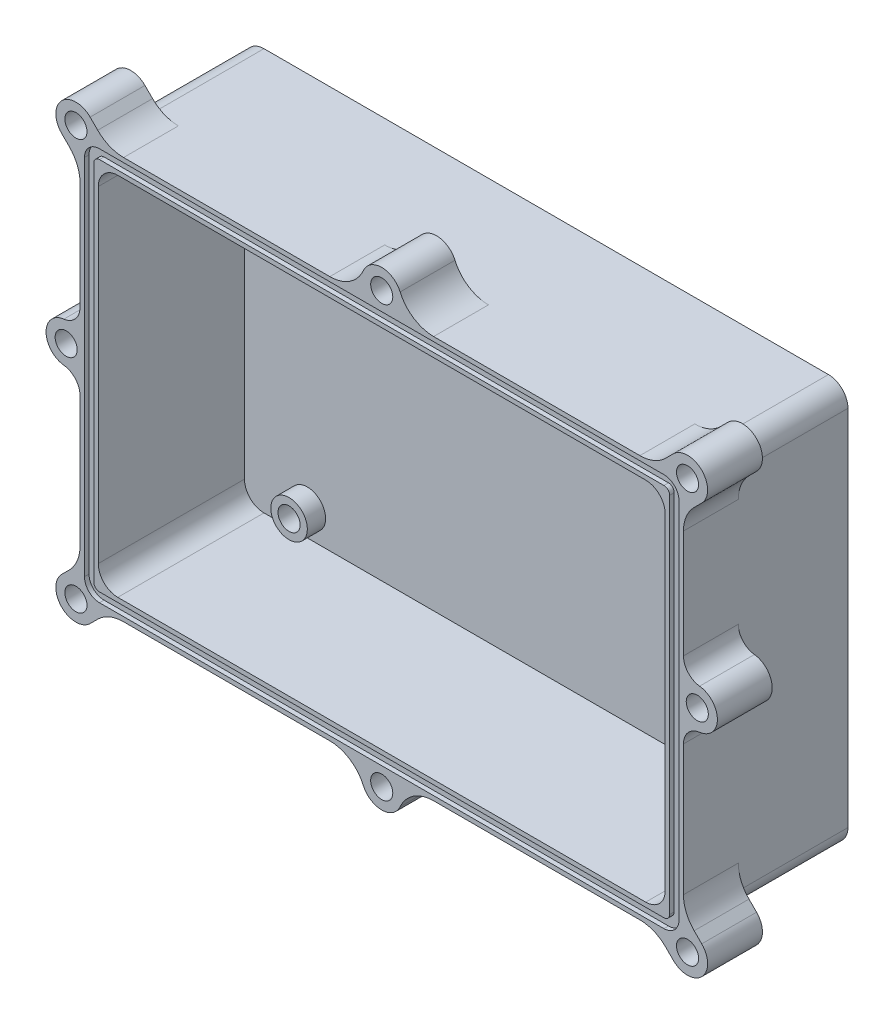
from build123d import *

# Parameters (mm, degrees)
SKETCH1_W               = 165.1
SKETCH1_H               = 110
BOSS_EXTRUDE1_DEPTH     = 45
SHELL1_T                = -5
FILLET1_R               = 5.334
CUT_EXTRUDE1_DEPTH      = 1.2446
BOSS_EXTRUDE2_DEPTH     = 15
SKETCH4_R               = 3.025
CUT_EXTRUDE2_DEPTH      = 8
MIRROR3_COPY_1_DEPTH    = 15
MIRROR3_COPY_2_SKETCH_R = 3.025
MIRROR3_COPY_2_DEPTH    = 8
FILLET3_R               = 10
BOSS_EXTRUDE3_DEPTH     = 15
SKETCH6_R               = 3.025
CUT_EXTRUDE3_DEPTH      = 8
FILLET5_R               = 10
BOSS_EXTRUDE4_DEPTH     = 15
SKETCH8_R               = 3.025
CUT_EXTRUDE4_DEPTH      = 8
FILLET6_R               = 5
SKETCH9_R               = 5
SKETCH9_R_2             = 3.025
BOSS_EXTRUDE5_DEPTH     = 5


with BuildPart() as part:
    # Sketch1 → Boss-Extrude1 (new body)
    with BuildSketch(Plane.XY):
        Rectangle(SKETCH1_W, SKETCH1_H)
    extrude(amount=BOSS_EXTRUDE1_DEPTH)

    # Shell1
    shell1_openings = [part.faces().sort_by_distance(p)[0] for p in [
        (0, 0, 45),
    ]]
    offset(amount=SHELL1_T, openings=shell1_openings, kind=Kind.INTERSECTION)

    # Fillet1
    fillet1_edges = [part.edges().sort_by_distance(p)[0] for p in [
        (77.55, -50, 25),
        (77.55, 50, 25),
        (-77.55, 50, 25),
        (-77.55, -50, 25),
        (82.55, -55, 22.5),
        (-82.55, -55, 22.5),
        (-82.55, 55, 22.5),
        (82.55, 55, 22.5),
    ]]
    fillet(fillet1_edges, radius=FILLET1_R)

    # Sketch2 → Cut-Extrude1 (cut)
    with BuildSketch(Plane.XY.offset(45)):
        with BuildLine():
            Line((-77.216, -53.7827), (77.216, -53.7827))
            ThreePointArc((77.216, -53.7827), (80.126946486, -52.576946486), (81.3327, -49.666))
            Line((81.3327, -49.666), (81.3327, 49.666))
            ThreePointArc((81.3327, 49.666), (80.126946486, 52.576946486), (77.216, 53.7827))
            Line((77.216, 53.7827), (-77.216, 53.7827))
            ThreePointArc((-77.216, 53.7827), (-80.126946486, 52.576946486), (-81.3327, 49.666))
            Line((-81.3327, 49.666), (-81.3327, -49.666))
            ThreePointArc((-81.3327, -49.666), (-80.126946486, -52.576946486), (-77.216, -53.7827))
        make_face()
        with BuildLine():
            Line((-78.7673, 49.666), (-78.7673, -49.666))
            ThreePointArc((-78.7673, -49.666), (-78.31293475, -50.76293475), (-77.216, -51.2173))
            Line((-77.216, -51.2173), (77.216, -51.2173))
            ThreePointArc((77.216, -51.2173), (78.31293475, -50.76293475), (78.7673, -49.666))
            Line((78.7673, -49.666), (78.7673, 49.666))
            ThreePointArc((78.7673, 49.666), (78.31293475, 50.76293475), (77.216, 51.2173))
            Line((77.216, 51.2173), (-77.216, 51.2173))
            ThreePointArc((-77.216, 51.2173), (-78.31293475, 50.76293475), (-78.7673, 49.666))
        make_face(mode=Mode.SUBTRACT)
    extrude(amount=-CUT_EXTRUDE1_DEPTH, mode=Mode.SUBTRACT)

    # Sketch3 → Boss-Extrude2 (add)
    with BuildSketch(Plane.XY.offset(45)):
        with BuildLine():
            ThreePointArc((80.987707571, 53.437707571), (82.143973426, 51.707233428), (82.55, 49.666))
            Line((82.55, 49.666), (82.55, 47.221825407))
            Line((82.55, 47.221825407), (87.551567689, 52.223393096))
            ThreePointArc((87.551567689, 52.223393096), (87.551567689, 60.001567689), (79.773393096, 60.001567689))
            Line((79.773393096, 60.001567689), (74.771825407, 55))
            Line((74.771825407, 55), (77.216, 55))
            ThreePointArc((77.216, 55), (79.257233428, 54.593973426), (80.987707571, 53.437707571))
        make_face()
    boss_extrude2 = extrude(amount=-BOSS_EXTRUDE2_DEPTH)

    # Sketch4 → Cut-Extrude2 (cut)
    with BuildSketch(Plane.XY.offset(45)):
        with Locations((83.662480392, 56.112480392)):
            Circle(SKETCH4_R)
    cut_extrude2 = extrude(amount=-CUT_EXTRUDE2_DEPTH, mode=Mode.SUBTRACT)

    # Mirror2: Boss-Extrude2, Cut-Extrude2 across plane
    add(boss_extrude2.mirror(Plane.ZX))
    add(cut_extrude2.mirror(Plane.ZX), mode=Mode.SUBTRACT)

    # Mirror3: Boss-Extrude2, Cut-Extrude2 across plane
    add(boss_extrude2.mirror(Plane(origin=(0, 0, 0), x_dir=(0, 0, 1), z_dir=(1, 0, 0))))
    add(cut_extrude2.mirror(Plane(origin=(0, 0, 0), x_dir=(0, 0, 1), z_dir=(1, 0, 0))), mode=Mode.SUBTRACT)

    # Mirror3 copy 1 sketch → Mirror3 copy 1 (add)
    with BuildSketch(Plane(origin=(0, 0, 45), x_dir=(-1, 0, 0), z_dir=(0, 0, 1))):
        with BuildLine():
            ThreePointArc((80.987707571, 53.437707571), (82.143973426, 51.707233428), (82.55, 49.666))
            Line((82.55, 49.666), (82.55, 47.221825407))
            Line((82.55, 47.221825407), (87.551567689, 52.223393096))
            ThreePointArc((87.551567689, 52.223393096), (87.551567689, 60.001567689), (79.773393096, 60.001567689))
            Line((79.773393096, 60.001567689), (74.771825407, 55))
            Line((74.771825407, 55), (77.216, 55))
            ThreePointArc((77.216, 55), (79.257233428, 54.593973426), (80.987707571, 53.437707571))
        make_face()
    extrude(amount=-MIRROR3_COPY_1_DEPTH)

    # Mirror3 copy 2 sketch → Mirror3 copy 2 (cut)
    with BuildSketch(Plane(origin=(0, 0, 45), x_dir=(-1, 0, 0), z_dir=(0, 0, 1))):
        with Locations((83.662480392, 56.112480392)):
            Circle(MIRROR3_COPY_2_SKETCH_R)
    extrude(amount=-MIRROR3_COPY_2_DEPTH, mode=Mode.SUBTRACT)

    # Fillet3
    fillet3_edges = [part.edges().sort_by_distance(p)[0] for p in [
        (82.55, 47.221825407, 37.5),
        (74.771825407, 55, 37.5),
        (82.55, -47.221825407, 37.5),
        (74.771825407, -55, 37.5),
        (-82.55, -47.221825407, 37.5),
        (-74.771825407, -55, 37.5),
        (-82.55, 47.221825407, 37.5),
        (-74.771825407, 55, 37.5),
    ]]
    fillet(fillet3_edges, radius=FILLET3_R)

    # Sketch5 → Boss-Extrude3 (add)
    with BuildSketch(Plane.XY.offset(45)):
        with BuildLine():
            Line((0, -55), (-5.5, -55))
            Line((-5.5, -55), (-5.5, -58.7827))
            ThreePointArc((-5.5, -58.7827), (0, -64.2827), (5.5, -58.7827))
            Line((5.5, -58.7827), (5.5, -55))
            Line((5.5, -55), (0, -55))
        make_face()
    boss_extrude3 = extrude(amount=-BOSS_EXTRUDE3_DEPTH)

    # Sketch6 → Cut-Extrude3 (cut)
    with BuildSketch(Plane.XY.offset(45)):
        with Locations((0, -58.7827)):
            Circle(SKETCH6_R)
    cut_extrude3 = extrude(amount=-CUT_EXTRUDE3_DEPTH, mode=Mode.SUBTRACT)

    # Mirror10: Boss-Extrude3, Cut-Extrude3 across plane
    add(boss_extrude3.mirror(Plane.ZX))
    add(cut_extrude3.mirror(Plane.ZX), mode=Mode.SUBTRACT)

    # Fillet5
    # the kernel refuses this fillet: 10 mm, written as the material it adds along each edge
    with BuildSketch(Plane(origin=(5.5, 55, 45), x_dir=(1, 0, 0), z_dir=(0, 0, -1)), Plane(origin=(-5.5, -55, 45), x_dir=(-1, 0, 0), z_dir=(0, 0, -1))) as fillet5_piece_1:
        with BuildLine():
            CenterArc((8.698421768, -10), FILLET5_R, 90, 66.352028346)
            Line((-0.46185034, -5.98883871), (-1.377877551, -5.587722581))
            ThreePointArc((-1.377877551, -5.587722581), (-1, -3.7827), (-1, 0))
            Line((-1, 0), (0, 1))
            Line((0, 1), (8.698421768, 1))
            Line((8.698421768, 1), (8.698421768, 0))
        make_face()
    extrude(amount=15)
    with BuildSketch(Plane(origin=(-5.5, 55, 45), x_dir=(-1, 0, 0), z_dir=(0, 0, -1)), Plane(origin=(5.5, -55, 45), x_dir=(1, 0, 0), z_dir=(0, 0, -1))) as fillet5_piece_2:
        with BuildLine():
            CenterArc((8.698421768, 10), FILLET5_R, 203.647971654, 66.352028346)
            Line((-0.46185034, 5.98883871), (-1.377877551, 5.587722581))
            ThreePointArc((-1.377877551, 5.587722581), (-1, 3.7827), (-1, 0))
            Line((-1, 0), (0, -1))
            Line((0, -1), (8.698421768, -1))
            Line((8.698421768, -1), (8.698421768, 0))
        make_face()
    extrude(amount=15)

    # Sketch7 → Boss-Extrude4 (add)
    with BuildSketch(Plane.XY.offset(45)):
        with BuildLine():
            Line((-82.55, 3.079689783), (-82.55, 8.579689783))
            Line((-82.55, 8.579689783), (-86.3327, 8.579689783))
            ThreePointArc((-86.3327, 8.579689783), (-91.8327, 3.079689783), (-86.3327, -2.420310217))
            Line((-86.3327, -2.420310217), (-82.55, -2.420310217))
            Line((-82.55, -2.420310217), (-82.55, 3.079689783))
        make_face()
    boss_extrude4 = extrude(amount=-BOSS_EXTRUDE4_DEPTH)

    # Sketch8 → Cut-Extrude4 (cut)
    with BuildSketch(Plane.XY.offset(45)):
        with Locations((-86.3327, 3.079689783)):
            Circle(SKETCH8_R)
    cut_extrude4 = extrude(amount=-CUT_EXTRUDE4_DEPTH, mode=Mode.SUBTRACT)

    # Mirror11: Boss-Extrude4, Cut-Extrude4 across plane
    add(boss_extrude4.mirror(Plane(origin=(0, 0, 0), x_dir=(0, 0, 1), z_dir=(1, 0, 0))))
    add(cut_extrude4.mirror(Plane(origin=(0, 0, 0), x_dir=(0, 0, 1), z_dir=(1, 0, 0))), mode=Mode.SUBTRACT)

    # Fillet6
    # the kernel refuses this fillet: 5 mm, written as the material it adds along each edge
    with BuildSketch(Plane(origin=(82.55, 8.579689783, 45), x_dir=(0, 1, 0), z_dir=(0, 0, -1)), Plane(origin=(-82.55, -2.420310217, 45), x_dir=(0, -1, 0), z_dir=(0, 0, -1))) as fillet6_piece_1:
        with BuildLine():
            CenterArc((4.929198469, 5), FILLET6_R, 186.657461203, 83.342538797)
            Line((-0.037086516, 4.420333333), (-0.533715015, 4.362366667))
            ThreePointArc((-0.533715015, 4.362366667), (-0.5, 3.7827), (-0.5, 0))
            Line((-0.5, 0), (0, -0.5))
            Line((0, -0.5), (4.929198469, -0.5))
            Line((4.929198469, -0.5), (4.929198469, 0))
        make_face()
    extrude(amount=15)
    with BuildSketch(Plane(origin=(82.55, -2.420310217, 45), x_dir=(0, -1, 0), z_dir=(0, 0, -1)), Plane(origin=(-82.55, 8.579689783, 45), x_dir=(0, 1, 0), z_dir=(0, 0, -1))) as fillet6_piece_2:
        with BuildLine():
            CenterArc((4.929198469, -5), FILLET6_R, 90, 83.342538797)
            Line((-0.037086516, -4.420333333), (-0.533715015, -4.362366667))
            ThreePointArc((-0.533715015, -4.362366667), (-0.5, -3.7827), (-0.5, 0))
            Line((-0.5, 0), (0, 0.5))
            Line((0, 0.5), (4.929198469, 0.5))
            Line((4.929198469, 0.5), (4.929198469, 0))
        make_face()
    extrude(amount=15)

    # Sketch9 → Boss-Extrude5 (add)
    # profile 1 of 4: a face of its own
    with BuildSketch(Plane.XY.offset(5)):
        with Locations((-60.35343772, -42.926)):
            Circle(SKETCH9_R)
        with Locations((-60.35343772, -42.926)):
            Circle(SKETCH9_R_2, mode=Mode.SUBTRACT)
    # profile 2 of 4: a face of its own
    with BuildSketch(Plane.XY.offset(5)):
        with Locations((50.13656228, -42.926)):
            Circle(SKETCH9_R)
        with Locations((50.13656228, -42.926)):
            Circle(SKETCH9_R_2, mode=Mode.SUBTRACT)
    # profile 3 of 4: a face of its own
    with BuildSketch(Plane.XY.offset(5)):
        with Locations((50.13656228, 12.954)):
            Circle(SKETCH9_R)
        with Locations((50.13656228, 12.954)):
            Circle(SKETCH9_R_2, mode=Mode.SUBTRACT)
    # profile 4 of 4: a face of its own
    with BuildSketch(Plane.XY.offset(5)):
        with Locations((-60.35343772, 42.799)):
            Circle(SKETCH9_R)
        with Locations((-60.35343772, 42.799)):
            Circle(SKETCH9_R_2, mode=Mode.SUBTRACT)
    extrude(amount=BOSS_EXTRUDE5_DEPTH)


solid = part.part
